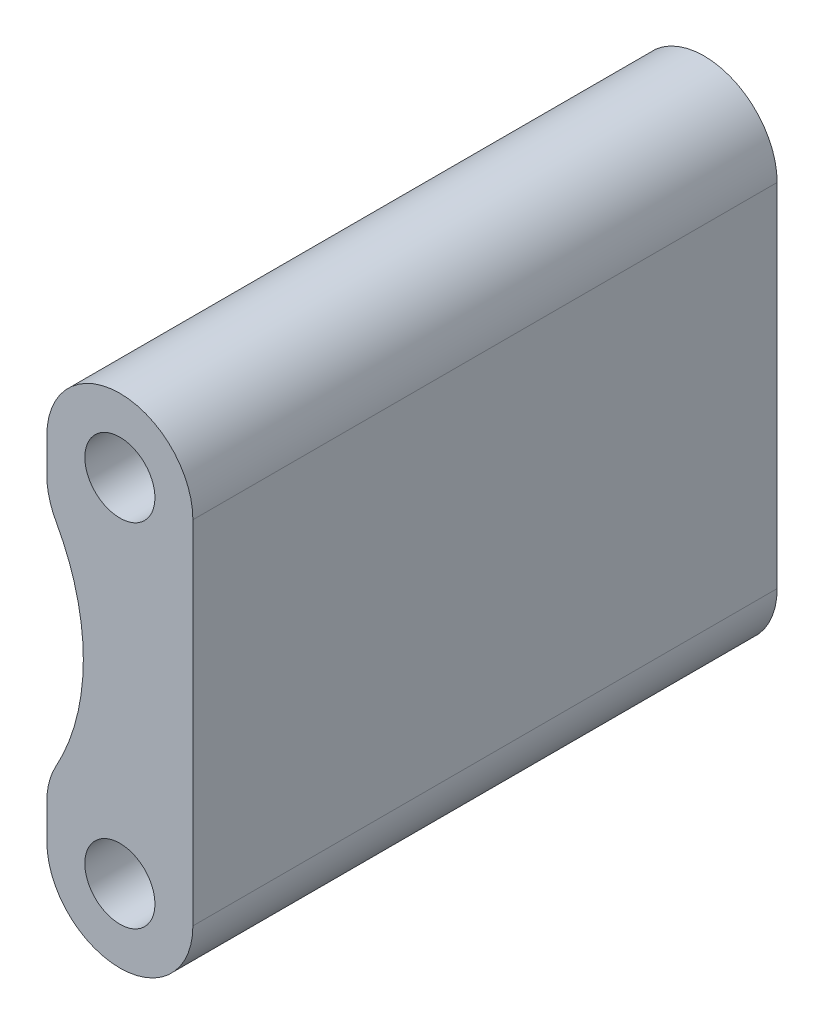
from build123d import *

# Parameters (mm, degrees)
SKETCH1_R           = 2.286
BOSS_EXTRUDE1_DEPTH = 38.1
SKETCH2_R           = 14.2875
CUT_EXTRUDE1_DEPTH  = 48.3445814
FILLET1_R           = 4.7625


with BuildPart() as part:
    # Sketch1 → Boss-Extrude1 (new body)
    with BuildSketch(Plane.XY):
        with BuildLine():
            Line((4.7625, 22.9362), (4.7625, 0))
            ThreePointArc((4.7625, 0), (0, -4.7625), (-4.7625, 0))
            Line((-4.7625, 0), (-4.7625, 22.9362))
            ThreePointArc((-4.7625, 22.9362), (0, 27.6987), (4.7625, 22.9362))
        make_face()
        Circle(SKETCH1_R, mode=Mode.SUBTRACT)
        with Locations((0, 22.9362)):
            Circle(SKETCH1_R, mode=Mode.SUBTRACT)
    extrude(amount=BOSS_EXTRUDE1_DEPTH)

    # Sketch2 → Cut-Extrude1 (cut, through all)
    with BuildSketch(Plane.XY.offset(38.1)):
        with Locations((-16.67002, 11.4681)):
            Circle(SKETCH2_R)
    extrude(amount=-CUT_EXTRUDE1_DEPTH, mode=Mode.SUBTRACT)

    # Fillet1
    fillet1_edges = [part.edges().sort_by_distance(p)[0] for p in [
        (-4.7625, 3.572302149, 19.05),
        (-4.7625, 19.363897851, 19.05),
    ]]
    fillet(fillet1_edges, radius=FILLET1_R)


solid = part.part
